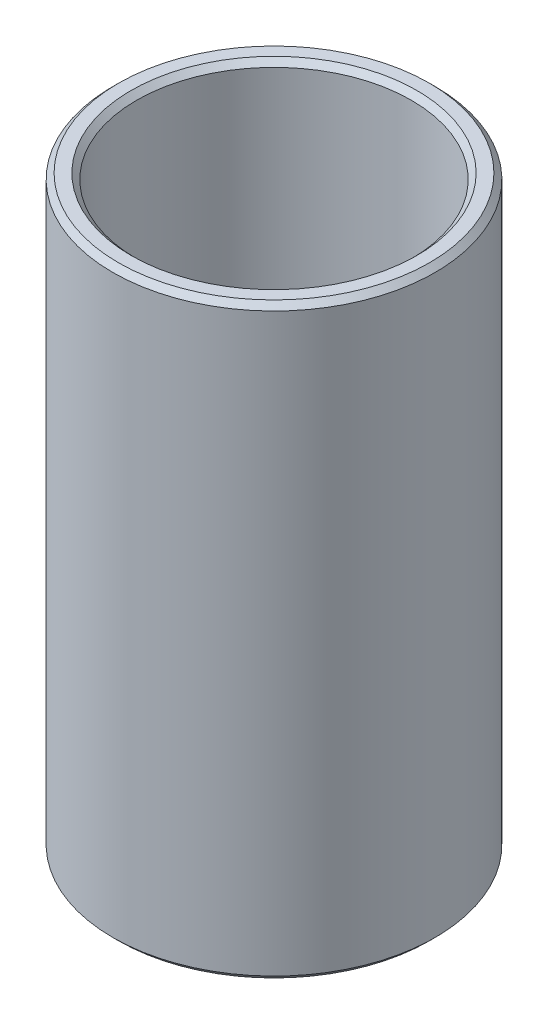
from build123d import *

# Parameters (mm, degrees)
SKETCH1_R           = 35
BOSS_EXTRUDE1_DEPTH = 127.542226721
SKETCH2_R           = 29.827897505
CUT_EXTRUDE1_DEPTH  = 137.810158969
CHAMFER1_SIZE       = 1.220539366


with BuildPart() as part:
    # Sketch1 → Boss-Extrude1 (new body)
    with BuildSketch(Plane(origin=(0, 0, 0), x_dir=(1, 0, 0), z_dir=(0, 1, 0))):
        Circle(SKETCH1_R)
    extrude(amount=BOSS_EXTRUDE1_DEPTH)

    # Sketch2 → Cut-Extrude1 (cut, through all)
    with BuildSketch(Plane(origin=(0, 0, 0), x_dir=(1, 0, 0), z_dir=(0, 1, 0))):
        Circle(SKETCH2_R)
    extrude(amount=CUT_EXTRUDE1_DEPTH, mode=Mode.SUBTRACT)

    # Chamfer1
    chamfer1_edges = [part.edges().sort_by_distance(p)[0] for p in [
        (-29.827897505, 127.542226721, 0),
        (-29.827897505, 0, 0),
        (-35, 0, 0),
        (-35, 127.542226721, 0),
    ]]
    chamfer(chamfer1_edges, length=CHAMFER1_SIZE)


solid = part.part
